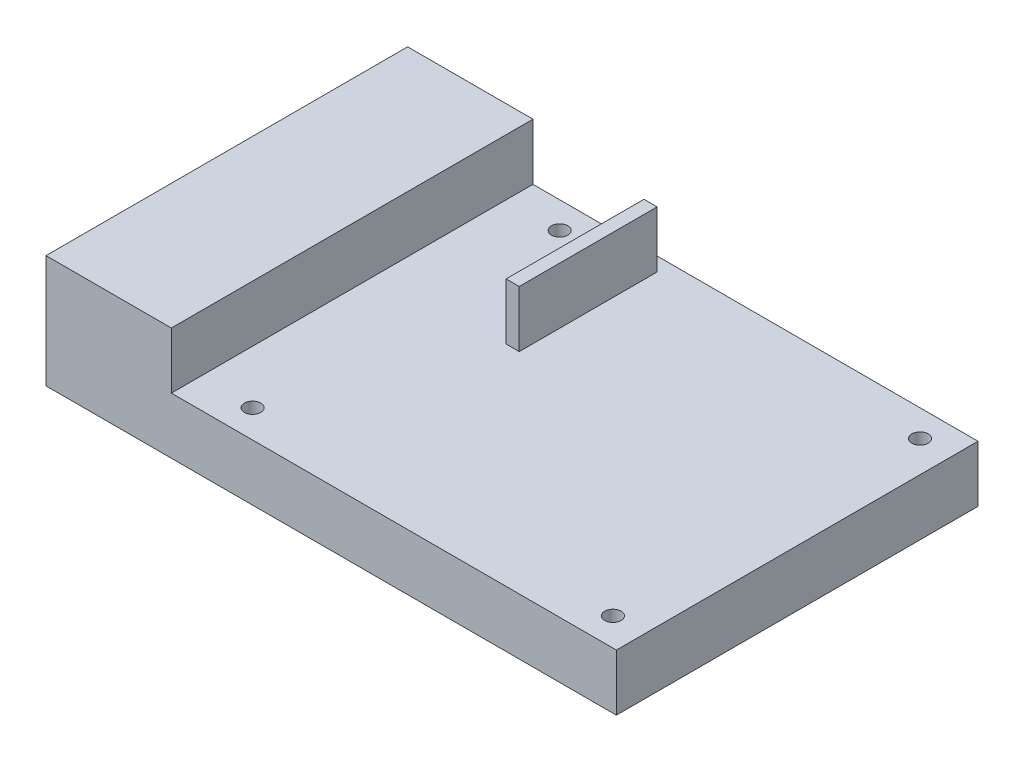
from build123d import *

# Parameters (mm, degrees)
SKETCH1_W             = 20
SKETCH1_H             = 57.7
BOSS_EXTRUDE1_DEPTH   = 18
SKETCH1_W_2           = 2.09336208
SKETCH1_H_2           = 22
BOSS_EXTRUDE1_2_DEPTH = 18
SKETCH1_3_W           = 71
SKETCH1_3_H           = 57.7
SKETCH1_3_R           = 1.3
SKETCH1_3_W_2         = 2.09336208
SKETCH1_3_H_2         = 22
BOSS_EXTRUDE2_DEPTH   = 9


with BuildPart() as part:
    # Sketch1 → Boss-Extrude1 (new body)
    with BuildSketch(Plane(origin=(0, 0, 0), x_dir=(1, 0, 0), z_dir=(0, 1, 0))):
        with Locations((10, -28.85)):
            Rectangle(SKETCH1_W, SKETCH1_H)
    extrude(amount=BOSS_EXTRUDE1_DEPTH)



with BuildPart() as body_2:
    # Sketch1 → Boss-Extrude1 2 (new body)
    with BuildSketch(Plane(origin=(0, 0, 0), x_dir=(1, 0, 0), z_dir=(0, 1, 0))):
        with Locations((40.96668104, -13.213993552)):
            Rectangle(SKETCH1_W_2, SKETCH1_H_2)
    extrude(amount=BOSS_EXTRUDE1_2_DEPTH)


with BuildPart() as part_1:
    add(part.part)

    add(body_2.part)  # Boss-Extrude2 merges body 2
    # Sketch1<3> → Boss-Extrude2 (add)
    with BuildSketch(Plane(origin=(0, 0, 0), x_dir=(1, 0, 0), z_dir=(0, 1, 0))):
        with Locations((55.5, -28.85)):
            Rectangle(SKETCH1_3_W, SKETCH1_3_H)
        with Locations((28.5, -53.244505087)):
            Circle(SKETCH1_3_R, mode=Mode.SUBTRACT)
        with Locations((86, -53.244505087)):
            Circle(SKETCH1_3_R, mode=Mode.SUBTRACT)
        with Locations((40.96668104, -13.213993552)):
            Rectangle(SKETCH1_3_W_2, SKETCH1_3_H_2, mode=Mode.SUBTRACT)
        with Locations((28.5, -4.244505087)):
            Circle(SKETCH1_3_R, mode=Mode.SUBTRACT)
        with Locations((86, -4.244505087)):
            Circle(SKETCH1_3_R, mode=Mode.SUBTRACT)
    extrude(amount=BOSS_EXTRUDE2_DEPTH)


solid = part_1.part
